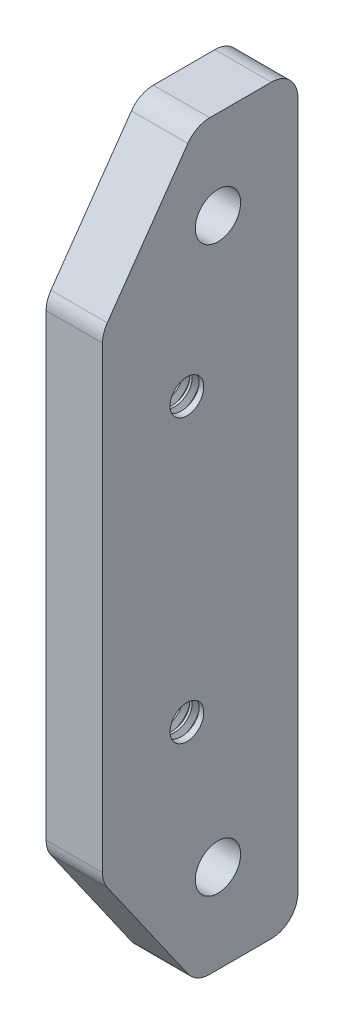
from build123d import *

# Parameters (mm, degrees)
BOSS_EXTRUDE1_DEPTH      = 3.175
BOSS_EXTRUDE1_DEPTH_BACK = 3.175
SKETCH1_W                = 21.99375
SKETCH1_H                = 83.5
SKETCH1_R                = 2.55
SKETCH1_R_2              = 1.89865
CHAMFER1_SIZE            = 15
CHAMFER1_SIZE2           = 10.503113073
CHAMFER2_SIZE            = 15
CHAMFER2_SIZE2           = 10.503113073
THREAD1_PITCH            = 1.058333333
THREAD2_PITCH            = 1.058333333
FILLET1_R                = 3


with BuildPart() as part:
    # Sketch1 → Boss-Extrude1 (new, two sides: drawn at the far end of the back side and taken through both)
    with BuildSketch(Plane(origin=(0, 0, 0), x_dir=(0, 0, -1), z_dir=(1, 0, 0)).offset(-BOSS_EXTRUDE1_DEPTH_BACK)):
        with Locations((-1.996875, 0)):
            Rectangle(SKETCH1_W, SKETCH1_H)
        with Locations((0, 31.75)):
            Circle(SKETCH1_R, mode=Mode.SUBTRACT)
        with Locations((0, -31.75)):
            Circle(SKETCH1_R, mode=Mode.SUBTRACT)
        with Locations((-3.49375, 15.875)):
            Circle(SKETCH1_R_2, mode=Mode.SUBTRACT)
        with Locations((-3.49375, -15.875)):
            Circle(SKETCH1_R_2, mode=Mode.SUBTRACT)
    extrude(amount=BOSS_EXTRUDE1_DEPTH + BOSS_EXTRUDE1_DEPTH_BACK)

    # Chamfer1
    chamfer1_edges = [part.edges().sort_by_distance(p)[0] for p in [
        (0, 41.75, 12.99375),
    ]]
    chamfer1_side = [part.faces().sort_by_distance(p)[0] for p in [
        (0, 0, 12.99375),
    ]]
    chamfer(chamfer1_edges, length=CHAMFER1_SIZE, length2=CHAMFER1_SIZE2, reference=chamfer1_side[0])

    # Chamfer2
    chamfer2_edges = [part.edges().sort_by_distance(p)[0] for p in [
        (0, -41.75, 12.99375),
    ]]
    chamfer2_side = [part.faces().sort_by_distance(p)[0] for p in [
        (0, -7.5, 12.99375),
    ]]
    chamfer(chamfer2_edges, length=CHAMFER2_SIZE, length2=CHAMFER2_SIZE2, reference=chamfer2_side[0])

    # Thread1: the profile of Thread Profile1 profile screwed along a right-hand helix of 9.448819 turns, 8 arcs to a turn; built about Z, then put on its axis
    thread1_z = Axis((0, 0, 0), (0, 0, 1))
    thread1_corners = [(1.89835, 0, -0.000173205), (2.471489718, 0, 0.330729165), (2.471489718, 0, 0.463020832), (1.89835, 0, 0.793923202)]
    with BuildLine(mode=Mode.PRIVATE) as thread1_profile:
        Line(thread1_corners[0], thread1_corners[1])
        Line(thread1_corners[1], thread1_corners[2])
        Line(thread1_corners[2], thread1_corners[3])
        Line(thread1_corners[3], thread1_corners[0])
    thread1_cap = Face(thread1_profile.wire())
    thread1_turn_angles = [0, 22.5, 45, 67.5, 90, 112.5, 135, 157.5, 180, 202.5, 225, 247.5, 270, 292.5, 315, 337.5, 360]
    thread1_turn_weights = [1, 0.9238795325112867, 1, 0.9238795325112867, 1, 0.9238795325112867, 1, 0.9238795325112867, 1, 0.9238795325112867, 1, 0.9238795325112867, 1, 0.9238795325112867, 1, 0.9238795325112867, 1]
    thread1_turn_rails = [Edge.make_bspline([Vector(p[0], p[1], 0).rotate(thread1_z, thread1_turn_angles[k]) / thread1_turn_weights[k] + Vector(0, 0, p[2] + THREAD1_PITCH * thread1_turn_angles[k] / 360) for k in range(17)], [0, 0, 0, 1, 1, 2, 2, 3, 3, 4, 4, 5, 5, 6, 6, 7, 7, 8, 8, 8], 2, thread1_turn_weights) for p in thread1_corners]
    thread1_turn_sides = [Face.make_surface_from_curves(thread1_turn_rails[p[0]], thread1_turn_rails[p[1]]) for p in [(0, 1), (1, 2), (2, 3), (3, 0)]]
    thread1_last_angles = [3240, 3262.5, 3285, 3307.5, 3330, 3352.5, 3375, 3388.287401575, 3401.57480315]
    thread1_last_weights = [1, 0.9238795325112867, 1, 0.9238795325112867, 1, 0.9238795325112867, 1, 0.9732294335070495, 1]
    thread1_last_rails = [Edge.make_bspline([Vector(p[0], p[1], 0).rotate(thread1_z, thread1_last_angles[k]) / thread1_last_weights[k] + Vector(0, 0, p[2] + THREAD1_PITCH * thread1_last_angles[k] / 360) for k in range(9)], [0, 0, 0, 1, 1, 2, 2, 3, 3, 4, 4, 4], 2, thread1_last_weights) for p in thread1_corners]
    thread1_last_sides = [Face.make_surface_from_curves(thread1_last_rails[p[0]], thread1_last_rails[p[1]]) for p in [(0, 1), (1, 2), (2, 3), (3, 0)]]
    thread1 = Plane(origin=(3.175, 15.875, 3.49375), x_dir=(0, 0, 1), z_dir=(-1, 0, 0)) * Solid(Shell([*[p.moved(Location((0, 0, THREAD1_PITCH * i))) for i in range(9) for p in thread1_turn_sides], *thread1_last_sides, thread1_cap, thread1_cap.rotate(thread1_z, 3401.57480315).moved(Location((0, 0, THREAD1_PITCH * 3401.57480315 / 360)))]))
    add(thread1, mode=Mode.SUBTRACT)

    # Thread2: the profile of Thread Profile2 profile screwed along a right-hand helix of 9.448819 turns, 8 arcs to a turn; built about Z, then put on its axis
    thread2_z = Axis((0, 0, 0), (0, 0, 1))
    thread2_corners = [(1.89835, 0, -0.000173205), (2.471489718, 0, 0.330729165), (2.471489718, 0, 0.463020832), (1.89835, 0, 0.793923202)]
    with BuildLine(mode=Mode.PRIVATE) as thread2_profile:
        Line(thread2_corners[0], thread2_corners[1])
        Line(thread2_corners[1], thread2_corners[2])
        Line(thread2_corners[2], thread2_corners[3])
        Line(thread2_corners[3], thread2_corners[0])
    thread2_cap = Face(thread2_profile.wire())
    thread2_turn_angles = [0, 22.5, 45, 67.5, 90, 112.5, 135, 157.5, 180, 202.5, 225, 247.5, 270, 292.5, 315, 337.5, 360]
    thread2_turn_weights = [1, 0.9238795325112867, 1, 0.9238795325112867, 1, 0.9238795325112867, 1, 0.9238795325112867, 1, 0.9238795325112867, 1, 0.9238795325112867, 1, 0.9238795325112867, 1, 0.9238795325112867, 1]
    thread2_turn_rails = [Edge.make_bspline([Vector(p[0], p[1], 0).rotate(thread2_z, thread2_turn_angles[k]) / thread2_turn_weights[k] + Vector(0, 0, p[2] + THREAD2_PITCH * thread2_turn_angles[k] / 360) for k in range(17)], [0, 0, 0, 1, 1, 2, 2, 3, 3, 4, 4, 5, 5, 6, 6, 7, 7, 8, 8, 8], 2, thread2_turn_weights) for p in thread2_corners]
    thread2_turn_sides = [Face.make_surface_from_curves(thread2_turn_rails[p[0]], thread2_turn_rails[p[1]]) for p in [(0, 1), (1, 2), (2, 3), (3, 0)]]
    thread2_last_angles = [3240, 3262.5, 3285, 3307.5, 3330, 3352.5, 3375, 3388.287401575, 3401.57480315]
    thread2_last_weights = [1, 0.9238795325112867, 1, 0.9238795325112867, 1, 0.9238795325112867, 1, 0.9732294335070495, 1]
    thread2_last_rails = [Edge.make_bspline([Vector(p[0], p[1], 0).rotate(thread2_z, thread2_last_angles[k]) / thread2_last_weights[k] + Vector(0, 0, p[2] + THREAD2_PITCH * thread2_last_angles[k] / 360) for k in range(9)], [0, 0, 0, 1, 1, 2, 2, 3, 3, 4, 4, 4], 2, thread2_last_weights) for p in thread2_corners]
    thread2_last_sides = [Face.make_surface_from_curves(thread2_last_rails[p[0]], thread2_last_rails[p[1]]) for p in [(0, 1), (1, 2), (2, 3), (3, 0)]]
    thread2 = Plane(origin=(3.175, -15.875, 3.49375), x_dir=(0, 0, 1), z_dir=(-1, 0, 0)) * Solid(Shell([*[p.moved(Location((0, 0, THREAD2_PITCH * i))) for i in range(9) for p in thread2_turn_sides], *thread2_last_sides, thread2_cap, thread2_cap.rotate(thread2_z, 3401.57480315).moved(Location((0, 0, THREAD2_PITCH * 3401.57480315 / 360)))]))
    add(thread2, mode=Mode.SUBTRACT)

    # Fillet1
    fillet1_edges = [part.edges().sort_by_distance(p)[0] for p in [
        (0, 41.75, 2.490636927),
        (0, 26.75, 12.99375),
        (0, -26.75, 12.99375),
        (0, -41.75, 2.490636927),
        (0, 41.75, -9),
        (0, -41.75, -9),
    ]]
    fillet(fillet1_edges, radius=FILLET1_R)


solid = part.part
